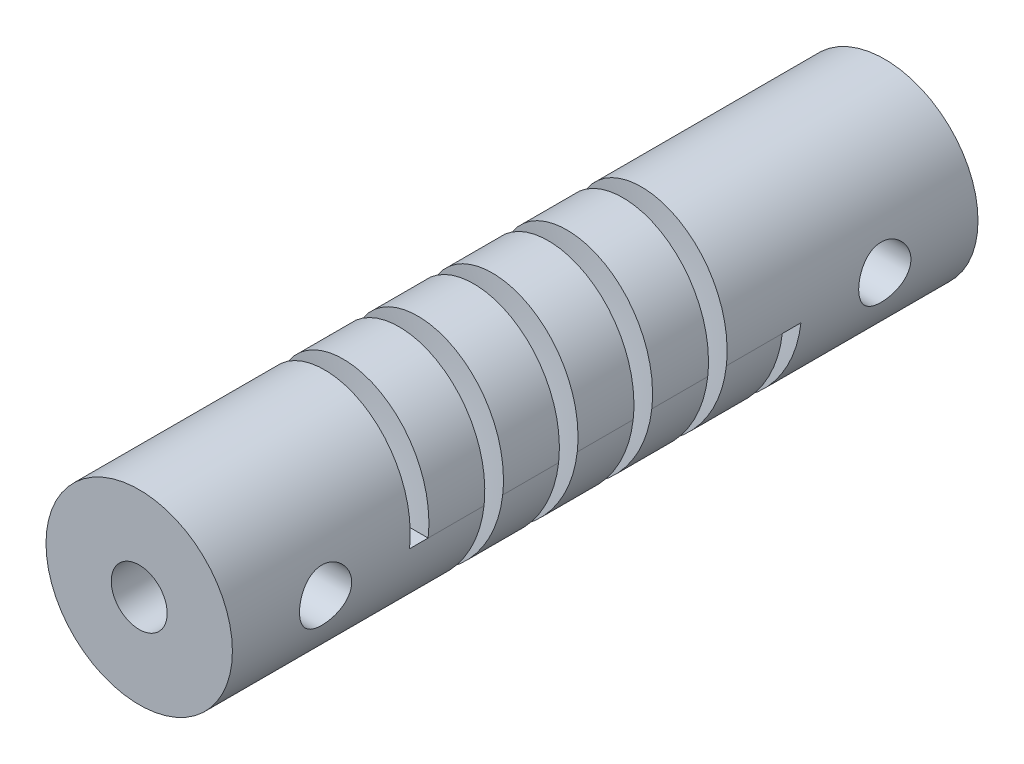
from build123d import *

# Parameters (mm, degrees)
CROQUIS1_R                 = 5
SALIENTE_EXTRUIR1_DEPTH    = 40
CROQUIS2_R                 = 1.5
CORTAR_EXTRUIR1_DEPTH      = 20
CROQUIS3_R                 = 2
CORTAR_EXTRUIR2_DEPTH      = 20
CORTAR_BARRER2_PITCH       = 4
CORTAR_EXTRUIR3_DEPTH      = 41.620192146
CORTAR_EXTRUIR3_DEPTH_BACK = 41.620192146
CROQUIS7_R                 = 1.4


with BuildPart() as part:
    # Croquis1 → Saliente-Extruir1 (new body)
    with BuildSketch(Plane.XY):
        Circle(CROQUIS1_R)
    extrude(amount=SALIENTE_EXTRUIR1_DEPTH)

    # Croquis2 → Cortar-Extruir1 (cut)
    with BuildSketch(Plane.XY.offset(40)):
        Circle(CROQUIS2_R)
    extrude(amount=-CORTAR_EXTRUIR1_DEPTH, mode=Mode.SUBTRACT)

    # Croquis3 → Cortar-Extruir2 (cut)
    with BuildSketch(Plane(origin=(0, 0, 0), x_dir=(-1, 0, 0), z_dir=(0, 0, -1))):
        Circle(CROQUIS3_R)
    extrude(amount=-CORTAR_EXTRUIR2_DEPTH, mode=Mode.SUBTRACT)

    # Cortar-Barrer2: the profile of Croquis6 screwed along a left-hand helix of 5 turns, 12 arcs to a turn; built about Z, then put on its axis
    cortar_barrer2_z = Axis((0, 0, 0), (0, 0, 1))
    cortar_barrer2_corners = [(5, 0, -0.5), (1, 0, -0.5), (1, 0, 0.5), (6.2, 0, 0.5), (6.2, 0, -0.5)]
    with BuildLine(mode=Mode.PRIVATE) as cortar_barrer2_profile:
        Line(cortar_barrer2_corners[0], cortar_barrer2_corners[1])
        Line(cortar_barrer2_corners[1], cortar_barrer2_corners[2])
        Line(cortar_barrer2_corners[2], cortar_barrer2_corners[3])
        Line(cortar_barrer2_corners[3], cortar_barrer2_corners[4])
        Line(cortar_barrer2_corners[4], cortar_barrer2_corners[0])
    cortar_barrer2_cap = Face(cortar_barrer2_profile.wire())
    cortar_barrer2_turn_angles = [0, -15, -30, -45, -60, -75, -90, -105, -120, -135, -150, -165, -180, -195, -210, -225, -240, -255, -270, -285, -300, -315, -330, -345, -360]
    cortar_barrer2_turn_weights = [1, 0.9659258262890683, 1, 0.9659258262890683, 1, 0.9659258262890683, 1, 0.9659258262890683, 1, 0.9659258262890683, 1, 0.9659258262890683, 1, 0.9659258262890683, 1, 0.9659258262890683, 1, 0.9659258262890683, 1, 0.9659258262890683, 1, 0.9659258262890683, 1, 0.9659258262890683, 1]
    cortar_barrer2_turn_rails = [Edge.make_bspline([Vector(p[0], p[1], 0).rotate(cortar_barrer2_z, cortar_barrer2_turn_angles[k]) / cortar_barrer2_turn_weights[k] + Vector(0, 0, p[2] + -CORTAR_BARRER2_PITCH * cortar_barrer2_turn_angles[k] / 360) for k in range(25)], [0, 0, 0, 1, 1, 2, 2, 3, 3, 4, 4, 5, 5, 6, 6, 7, 7, 8, 8, 9, 9, 10, 10, 11, 11, 12, 12, 12], 2, cortar_barrer2_turn_weights) for p in cortar_barrer2_corners]
    cortar_barrer2_turn_sides = [Face.make_surface_from_curves(cortar_barrer2_turn_rails[p[0]], cortar_barrer2_turn_rails[p[1]]) for p in [(0, 1), (1, 2), (2, 3), (3, 4), (4, 0)]]
    cortar_barrer2 = Plane(origin=(0, 0, 10), x_dir=(1, 0, 0), z_dir=(0, 0, 1)) * Solid(Shell([*[p.moved(Location((0, 0, CORTAR_BARRER2_PITCH * i))) for i in range(5) for p in cortar_barrer2_turn_sides], cortar_barrer2_cap, cortar_barrer2_cap.rotate(cortar_barrer2_z, -1800).moved(Location((0, 0, -CORTAR_BARRER2_PITCH * -1800 / 360)))]))
    add(cortar_barrer2, mode=Mode.SUBTRACT)

    # Croquis7 → Cortar-Extruir3 (cut, two sides: drawn at the far end of the back side and taken through both)
    with BuildSketch(Plane(origin=(0, 0, 0), x_dir=(0, 0, -1), z_dir=(1, 0, 0)).offset(-CORTAR_EXTRUIR3_DEPTH_BACK)):
        with Locations((-5, 0)):
            Circle(CROQUIS7_R)
        with Locations((-35, 0)):
            Circle(CROQUIS7_R)
    extrude(amount=CORTAR_EXTRUIR3_DEPTH + CORTAR_EXTRUIR3_DEPTH_BACK, mode=Mode.SUBTRACT)


solid = part.part
